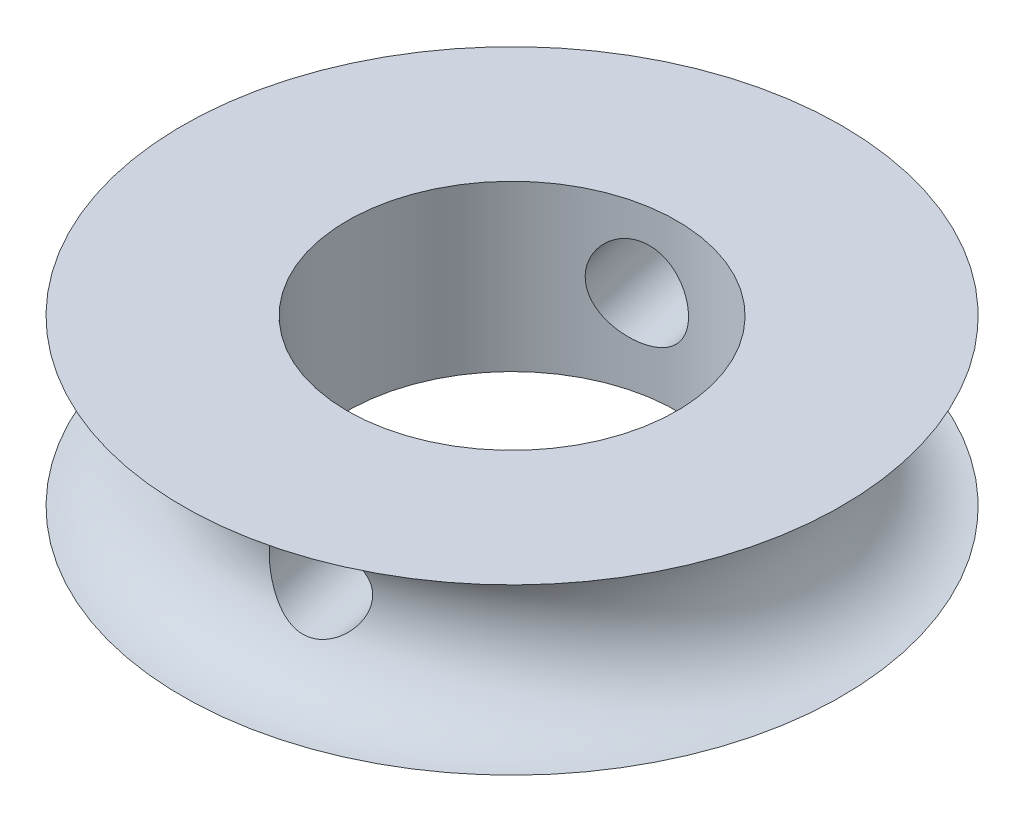
from build123d import *

# Parameters (mm, degrees)
SKETCH117_R                     = 3
CUT_EXTRUDE4_DEPTH              = 3
M2X0_4_TAPPED_HOLE1_D           = 1.6
M2X0_4_TAPPED_HOLE1_ON_FACE_2_D = 1.6


with BuildPart() as part:
    # Sketch9 → Revolve1 (revolve)
    with BuildSketch(Plane.XY):
        with BuildLine():
            Line((2.296910859, -2.935363462), (8.296910859, -2.935363462))
            Line((8.296910859, -2.935363462), (8.296910859, 0.064636538))
            Line((8.296910859, 0.064636538), (2.296910859, 0.064636538))
            ThreePointArc((2.296910859, 0.064636538), (3.796910859, -1.435363462), (2.296910859, -2.935363462))
        make_face()
    revolve(axis=Axis((8.296910859, -2.935363462, 0), (0, 1, 0)))

    # Sketch117 → Cut-Extrude4 (cut)
    with BuildSketch(Plane(origin=(0, 0.064636538, 0), x_dir=(1, 0, 0), z_dir=(0, 1, 0))):
        with Locations((8.29691086, 0)):
            Circle(SKETCH117_R)
    extrude(amount=-CUT_EXTRUDE4_DEPTH, mode=Mode.SUBTRACT)

    # M2x0.4 Tapped Hole1 (through all)
    with Locations(Plane(origin=(9.175343428, -1.418051097, 4.413530946), x_dir=(0.980762879785, 0, -0.195202903756), z_dir=(0.195189902029, -0.011541576938, 0.98069755488))):
        with Locations((0, 0)):
            Hole(M2X0_4_TAPPED_HOLE1_D / 2)

    # M2x0.4 Tapped Hole1 on face 2 (through all)
    with Locations(Plane(origin=(10.699205941, 2.424717807, 0), x_dir=(0.980762879785, 0, -0.195202903756), z_dir=(0.195189902029, -0.011541576938, 0.98069755488))):
        with Locations((0, 0)):
            Hole(M2X0_4_TAPPED_HOLE1_ON_FACE_2_D / 2)


solid = part.part
